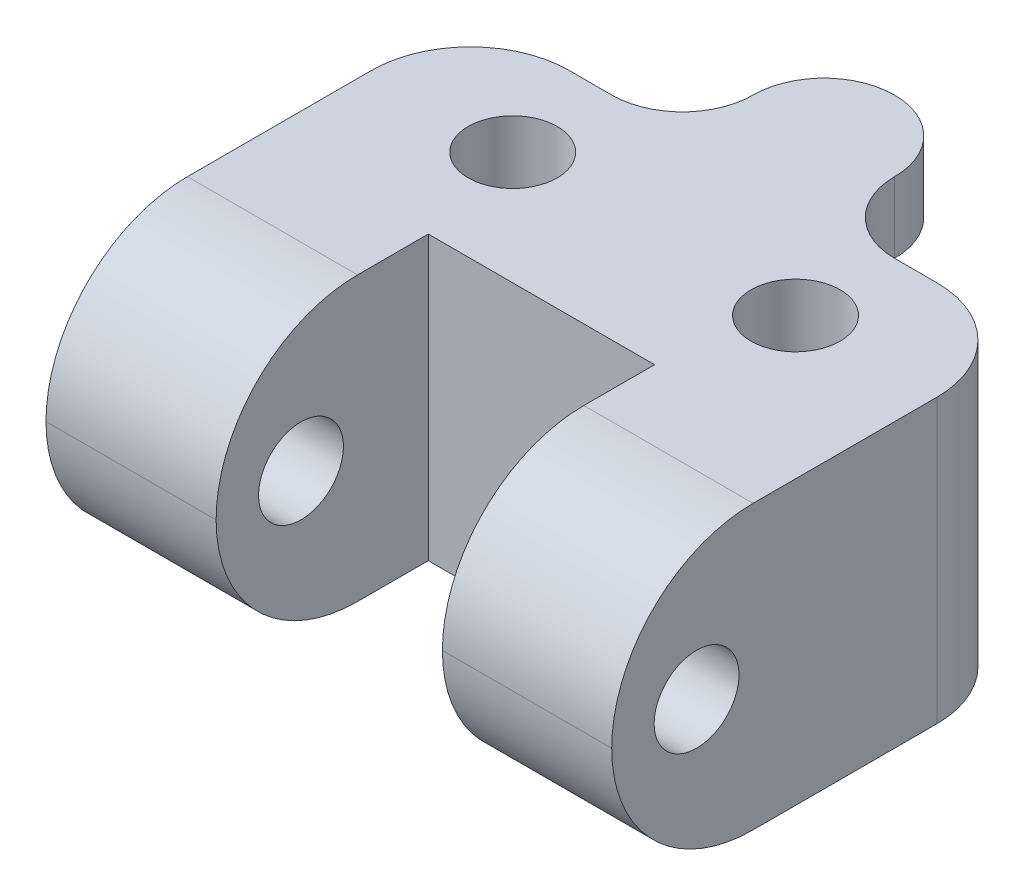
from build123d import *

# Parameters (mm, degrees)
SKETCH1_W           = 40
SKETCH1_H           = 30
BOSS_EXTRUDE1_DEPTH = 20
SKETCH2_R           = 3.15
SKETCH2_W           = 16
SKETCH2_H           = 15
CUT_EXTRUDE1_DEPTH  = 20
SKETCH3_W           = 10
SKETCH3_H           = 5
BOSS_EXTRUDE2_DEPTH = 10
FILLET3_R           = 5
FILLET4_R           = 5
SKETCH6_R           = 3
CUT_EXTRUDE3_DEPTH  = 140
FILLET5_R           = 10
FILLET6_R           = 5
FILLET7_R           = 7


with BuildPart() as part:
    # Sketch1 → Boss-Extrude1 (new body)
    with BuildSketch(Plane(origin=(0, 0, 0), x_dir=(1, 0, 0), z_dir=(0, 1, 0))):
        with Locations((20, 15)):
            Rectangle(SKETCH1_W, SKETCH1_H)
    extrude(amount=BOSS_EXTRUDE1_DEPTH)

    # Sketch2 → Cut-Extrude1 (cut)
    with BuildSketch(Plane(origin=(0, 20, 0), x_dir=(1, 0, 0), z_dir=(0, 1, 0))):
        with Locations(Location((10, 23, 0), (0, 0, 270))):
            Circle(SKETCH2_R)
        with Locations(Location((30, 23, 0), (0, 0, 270))):
            Circle(SKETCH2_R)
        with Locations((20.029547187, 7.5)):
            Rectangle(SKETCH2_W, SKETCH2_H)
    extrude(amount=-CUT_EXTRUDE1_DEPTH, mode=Mode.SUBTRACT)

    # Sketch3 → Boss-Extrude2 (add)
    with BuildSketch(Plane(origin=(0, 0, -30), x_dir=(-1, 0, 0), z_dir=(0, 0, -1))):
        with Locations((-20, 17.5)):
            Rectangle(SKETCH3_W, SKETCH3_H)
    extrude(amount=BOSS_EXTRUDE2_DEPTH)

    # Fillet3
    fillet3_edges = [part.edges().sort_by_distance(p)[0] for p in [
        (25, 17.5, -30),
        (15, 17.5, -30),
    ]]
    fillet(fillet3_edges, radius=FILLET3_R)

    # Fillet4
    fillet4_edges = [part.edges().sort_by_distance(p)[0] for p in [
        (20, 15, -30),
    ]]
    fillet(fillet4_edges, radius=FILLET4_R)

    # Sketch6 → Cut-Extrude3 (cut)
    with BuildSketch(Plane.ZY):
        with Locations((-6, 10)):
            Circle(SKETCH6_R)
    extrude(amount=-CUT_EXTRUDE3_DEPTH, mode=Mode.SUBTRACT)

    # Fillet5
    fillet5_edges = [part.edges().sort_by_distance(p)[0] for p in [
        (34.014773594, 20, 0),
        (34.014773594, 0, 0),
        (6.014773594, 0, 0),
        (6.014773594, 20, 0),
    ]]
    fillet(fillet5_edges, radius=FILLET5_R - 0.0001)  # a hair under: the kernel refuses the full size

    # Fillet6
    fillet6_edges = [part.edges().sort_by_distance(p)[0] for p in [
        (25, 17.5, -40),
        (15, 17.5, -40),
    ]]
    fillet(fillet6_edges, radius=FILLET6_R - 0.0001)  # a hair under: the kernel refuses the full size

    # Fillet7
    fillet7_edges = [part.edges().sort_by_distance(p)[0] for p in [
        (0, 10, -30),
        (40, 10, -30),
    ]]
    fillet(fillet7_edges, radius=FILLET7_R)


solid = part.part
